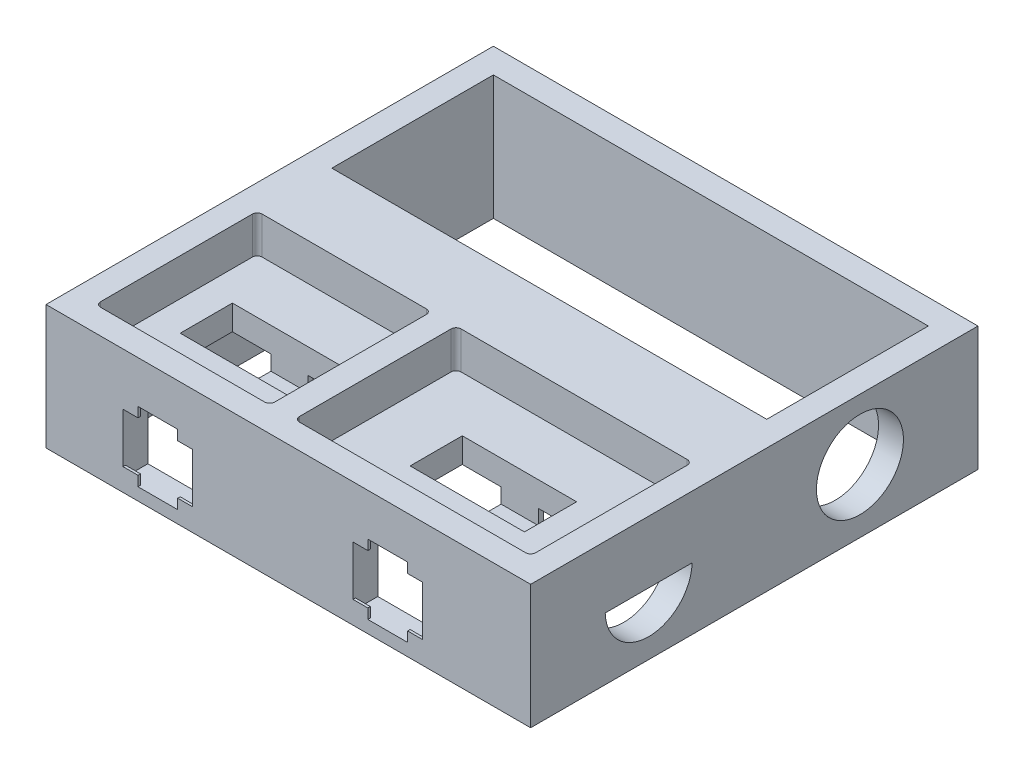
from build123d import *

# Parameters (mm, degrees)
SKETCH2_W            = 195
SKETCH2_H            = 180
BOSS_EXTRUDE1_DEPTH  = 50
CUT_EXTRUDE1_DEPTH   = 15
BOSS_EXTRUDE4_DEPTH  = 50
SKETCH14_W           = 70
SKETCH14_H           = 65
SKETCH14_W_2         = 95
BOSS_EXTRUDE8_DEPTH  = 35
SHELL2_OUTLINE_W     = 175
SHELL2_OUTLINE_H     = 65
SHELL2_DEPTH         = 75
SHELL2_2_OUTLINE_W   = 175
SHELL2_2_OUTLINE_H   = 95
SHELL2_2_DEPTH       = 25
SHELL2_START         = 25
SHELL2_3_DEPTH       = 15
SKETCH15_W           = 46
SKETCH15_H           = 21
CUT_EXTRUDE2_DEPTH   = 10
SKETCH16_W           = 46
SKETCH16_H           = 21
CUT_EXTRUDE3_DEPTH   = 10
SKETCH17_W           = 7.5
SKETCH17_H           = 8
BOSS_EXTRUDE10_DEPTH = 2
SKETCH18_W           = 15
SKETCH18_H           = 2
BOSS_EXTRUDE11_DEPTH = 15
CUT_EXTRUDE5_DEPTH   = 10
CUT_EXTRUDE6_DEPTH   = 9
SKETCH25_W           = 7.379331851
SKETCH25_H           = 8
SKETCH25_W_2         = 7.620668149
BOSS_EXTRUDE12_DEPTH = 2
SKETCH26_W           = 15
SKETCH26_H           = 2
BOSS_EXTRUDE13_DEPTH = 15
SKETCH27_R           = 17.5
CUT_EXTRUDE10_DEPTH  = 10
BOSS_EXTRUDE14_START = -10
BOSS_EXTRUDE14_DEPTH = 10


# Read off the part's stored shape, not the designer's step: Shell2
with BuildPart() as part:
    # Sketch2 → Boss-Extrude1 (new body)
    with BuildSketch(Plane(origin=(0, 0, 0), x_dir=(1, 0, 0), z_dir=(0, 1, 0))):
        with Locations((97.5, 90)):
            Rectangle(SKETCH2_W, SKETCH2_H)
    extrude(amount=BOSS_EXTRUDE1_DEPTH)

    # Sketch3 → Cut-Extrude1 (cut)
    with BuildSketch(Plane(origin=(0, 50, 0), x_dir=(1, 0, 0), z_dir=(0, 1, 0))):
        with BuildLine():
            Line((90, 12), (90, 73))
            ThreePointArc((90, 73), (90.585786438, 74.414213562), (92, 75))
            Line((92, 75), (183, 75))
            ThreePointArc((183, 75), (184.414213562, 74.414213562), (185, 73))
            Line((185, 73), (185, 12))
            ThreePointArc((185, 12), (184.414213562, 10.585786438), (183, 10))
            Line((183, 10), (92, 10))
            ThreePointArc((92, 10), (90.585786438, 10.585786438), (90, 12))
        make_face()
        with BuildLine():
            Line((12, 10), (78, 10))
            ThreePointArc((78, 10), (79.414213562, 10.585786438), (80, 12))
            Line((80, 12), (80, 73))
            ThreePointArc((80, 73), (79.414213562, 74.414213562), (78, 75))
            Line((78, 75), (12, 75))
            ThreePointArc((12, 75), (10.585786438, 74.414213562), (10, 73))
            Line((10, 73), (10, 12))
            ThreePointArc((10, 12), (10.585786438, 10.585786438), (12, 10))
        make_face()
    extrude(amount=-CUT_EXTRUDE1_DEPTH, mode=Mode.SUBTRACT)

    # Sketch6 → Boss-Extrude4 (add)
    with BuildSketch(Plane(origin=(0, 50, 0), x_dir=(1, 0, 0), z_dir=(0, 1, 0))):
        Polygon((0, 180), (185, 180), (195, 180), (195, 95), (185, 95), (0, 95), align=None)
        with BuildLine():
            Line((185, 168), (185, 107))
            ThreePointArc((185, 107), (184.414213562, 105.585786438), (183, 105))
            Line((183, 105), (92, 105))
            ThreePointArc((92, 105), (90.585786438, 105.585786438), (90, 107))
            Line((90, 107), (90, 168))
            ThreePointArc((90, 168), (90.585786438, 169.414213562), (92, 170))
            Line((92, 170), (183, 170))
            ThreePointArc((183, 170), (184.414213562, 169.414213562), (185, 168))
        make_face(mode=Mode.SUBTRACT)
        with BuildLine():
            Line((80, 107), (80, 168))
            ThreePointArc((80, 168), (79.414213562, 169.414213562), (78, 170))
            Line((78, 170), (12, 170))
            ThreePointArc((12, 170), (10.585786438, 169.414213562), (10, 168))
            Line((10, 168), (10, 107))
            ThreePointArc((10, 107), (10.585786438, 105.585786438), (12, 105))
            Line((12, 105), (78, 105))
            ThreePointArc((78, 105), (79.414213562, 105.585786438), (80, 107))
        make_face(mode=Mode.SUBTRACT)
    extrude(amount=BOSS_EXTRUDE4_DEPTH)

    # Sketch14 → Boss-Extrude8 (add)
    with BuildSketch(Plane(origin=(0, 50, 0), x_dir=(1, 0, 0), z_dir=(0, 1, 0))):
        with Locations((45, 137.5)):
            Rectangle(SKETCH14_W, SKETCH14_H)
        with Locations((137.5, 137.5)):
            Rectangle(SKETCH14_W_2, SKETCH14_H)
    extrude(amount=BOSS_EXTRUDE8_DEPTH)

    # Shell2 outline → Shell2 (cut)
    with BuildSketch(Plane(origin=(0, 0, 0), x_dir=(1, 0, 0), z_dir=(0, 1, 0))):
        with Locations((97.5, 137.5)):
            Rectangle(SHELL2_OUTLINE_W, SHELL2_OUTLINE_H)
    extrude(amount=SHELL2_DEPTH, mode=Mode.SUBTRACT)

    # Shell2 2 outline → Shell2 2 (cut)
    with BuildSketch(Plane(origin=(0, 0, 0), x_dir=(1, 0, 0), z_dir=(0, 1, 0))):
        with Locations((97.5, 57.5)):
            Rectangle(SHELL2_2_OUTLINE_W, SHELL2_2_OUTLINE_H)
    extrude(amount=SHELL2_2_DEPTH, mode=Mode.SUBTRACT)

    # Shell2 3 outline → Shell2 3 (cut)
    with BuildSketch(Plane(origin=(0, 0, 0), x_dir=(1, 0, 0), z_dir=(0, 1, 0)).offset(SHELL2_START)):
        with BuildLine():
            Line((10, 105), (10, 84.832159566))
            ThreePointArc((10, 84.832159566), (10.996484877, 84.957966273), (12, 85))
            Line((12, 85), (78, 85))
            ThreePointArc((78, 85), (81.676851089, 84.422817781), (85, 82.746794345))
            ThreePointArc((85, 82.746794345), (88.323148911, 84.422817781), (92, 85))
            Line((92, 85), (183, 85))
            ThreePointArc((183, 85), (184.003515123, 84.957966273), (185, 84.832159566))
            Line((185, 84.832159566), (185, 105))
            Line((185, 105), (10, 105))
        make_face()
    extrude(amount=SHELL2_3_DEPTH, mode=Mode.SUBTRACT)

    # SurfaceCut2
    split(bisect_by=Plane(origin=(0, 50, 0), x_dir=(1, 0, 0), z_dir=(0, 1, 0)), keep=Keep.BOTTOM)

    # Sketch15 → Cut-Extrude2 (cut)
    with BuildSketch(Plane(origin=(0, 35, 0), x_dir=(1, 0, 0), z_dir=(0, 1, 0))):
        with Locations((45, 42.5)):
            Rectangle(SKETCH15_W, SKETCH15_H)
    extrude(amount=-CUT_EXTRUDE2_DEPTH, mode=Mode.SUBTRACT)

    # Sketch16 → Cut-Extrude3 (cut)
    with BuildSketch(Plane(origin=(0, 35, 0), x_dir=(1, 0, 0), z_dir=(0, 1, 0))):
        with Locations((137.5, 42.5)):
            Rectangle(SKETCH16_W, SKETCH16_H)
    extrude(amount=-CUT_EXTRUDE3_DEPTH, mode=Mode.SUBTRACT)

    # Sketch17 → Boss-Extrude10 (add)
    with BuildSketch(Plane.XY.offset(-53)):
        with Locations((48.75, 21)):
            Rectangle(SKETCH17_W, SKETCH17_H)
        with Locations((41.25, 21)):
            Rectangle(SKETCH17_W, SKETCH17_H)
    extrude(amount=-BOSS_EXTRUDE10_DEPTH)

    # Sketch18 → Boss-Extrude11 (add)
    with BuildSketch(Plane.XY.offset(-53)):
        with Locations((45, 18)):
            Rectangle(SKETCH18_W, SKETCH18_H)
    extrude(amount=BOSS_EXTRUDE11_DEPTH)

    # Sketch20 → Cut-Extrude5 (cut)
    with BuildSketch(Plane.XY):
        Polygon((37, 29), (31, 29), (31, 9), (37, 9), (37, 5), (45, 5), (53, 5), (53, 9), (59, 9), (59, 19), (59, 29), (53, 29), (53, 33), (43.658923735, 33), (37, 33), align=None)
    cut_extrude5 = extrude(amount=-CUT_EXTRUDE5_DEPTH, mode=Mode.SUBTRACT)

    # Sketch21 → Cut-Extrude6 (cut)
    with BuildSketch(Plane(origin=(0, 0, -10), x_dir=(-1, 0, 0), z_dir=(0, 0, -1))):
        Polygon((-53, 5), (-31, 5), (-31, 12.573974865), (-31, 33), (-52.681459042, 33), (-59, 33), (-59, 15.767843478), (-59, 5), align=None)
    cut_extrude6 = extrude(amount=-CUT_EXTRUDE6_DEPTH, mode=Mode.SUBTRACT)

    # Sketch25 → Boss-Extrude12 (add)
    with BuildSketch(Plane.XY.offset(-53)):
        with Locations((133.810334075, 21)):
            Rectangle(SKETCH25_W, SKETCH25_H)
        with Locations((141.310334075, 21)):
            Rectangle(SKETCH25_W_2, SKETCH25_H)
    extrude(amount=-BOSS_EXTRUDE12_DEPTH)

    # Sketch26 → Boss-Extrude13 (add)
    with BuildSketch(Plane.XY.offset(-53)):
        with Locations((137.620668149, 18)):
            Rectangle(SKETCH26_W, SKETCH26_H)
    extrude(amount=BOSS_EXTRUDE13_DEPTH)

    # Mirror4: Cut-Extrude5, Cut-Extrude6 across plane
    add(cut_extrude5.mirror(Plane(origin=(91.25, 0, 0), x_dir=(0, 0, 1), z_dir=(1, 0, 0))), mode=Mode.SUBTRACT)
    add(cut_extrude6.mirror(Plane(origin=(91.25, 0, 0), x_dir=(0, 0, 1), z_dir=(1, 0, 0))), mode=Mode.SUBTRACT)

    # Sketch27 → Cut-Extrude10 (cut)
    with BuildSketch(Plane.ZY.offset(-185)):
        with Locations((-132.5, 25.5)):
            Circle(SKETCH27_R)
        with BuildLine():
            ThreePointArc((-64.985711369, 25), (-59.689166602, 12.950099602), (-47.492855685, 8))
            ThreePointArc((-47.492855685, 8), (-35.296544767, 12.950099602), (-30, 25))
            Line((-30, 25), (-64.985711369, 25))
        make_face()
        with BuildLine():
            Line((-64.985711369, 25), (-30, 25))
            ThreePointArc((-30, 25), (-29.994641855, 25.249974481), (-29.992855685, 25.5))
            ThreePointArc((-29.992855685, 25.5), (-47.742881204, 42.99821383), (-64.985711369, 25))
        make_face()
    extrude(amount=-CUT_EXTRUDE10_DEPTH, mode=Mode.SUBTRACT)

    # Sketch28 → Boss-Extrude14 (add)
    with BuildSketch(Plane(origin=(195, 0, 0), x_dir=(0, 0, -1), z_dir=(1, 0, 0)).offset(BOSS_EXTRUDE14_START)):
        with BuildLine():
            Line((30, 25), (64.985711369, 25))
            ThreePointArc((64.985711369, 25), (47.492855685, 43), (30, 25))
        make_face()
    extrude(amount=BOSS_EXTRUDE14_DEPTH)


solid = part.part
